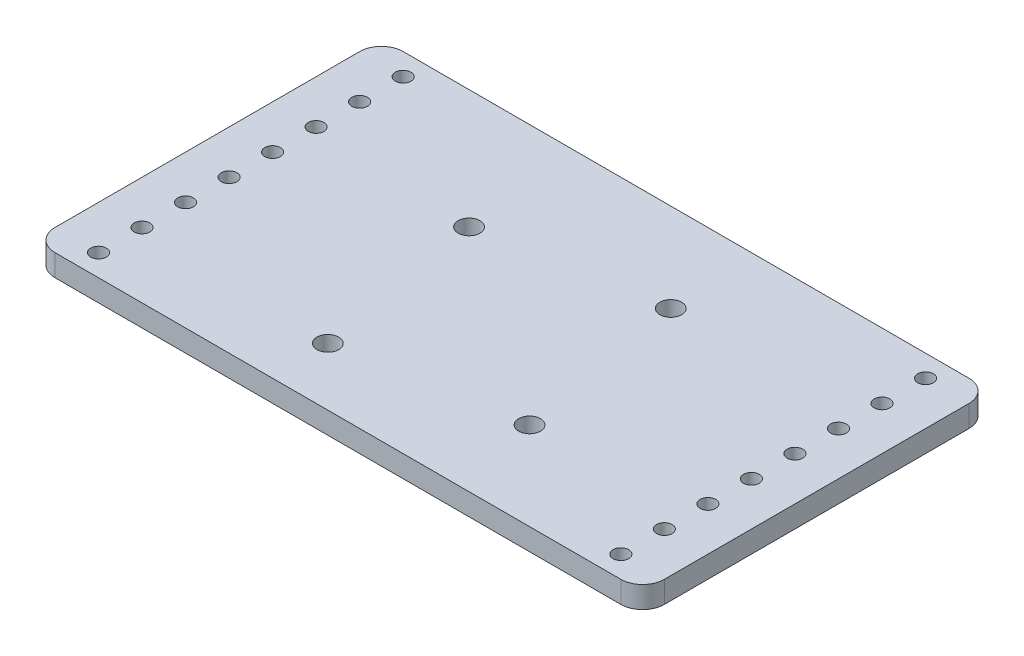
from build123d import *

# Parameters (mm, degrees)
SKETCH1_W                   = 177.8
SKETCH1_H                   = 101.6
INITIAL_PLATE_DEPTH         = 6.35
SKETCH2_R                   = 3.175
BEARING_STACK_HOLES_DEPTH   = 103.587389576
SKETCH3_R                   = 2.286
INITIAL_MOUNTING_HOLE_DEPTH = 103.587389576
MOUNTING_PATTERN_COUNT      = 8
MOUNTING_PATTERN_PITCH      = 12.7
FILLET1_R                   = 6.35


with BuildPart() as part:
    # Sketch1 → Initial Plate (new body)
    with BuildSketch(Plane(origin=(0, 0, 0), x_dir=(1, 0, 0), z_dir=(0, 1, 0))):
        Rectangle(SKETCH1_W, SKETCH1_H)
    extrude(amount=INITIAL_PLATE_DEPTH)

    # Sketch2 → Bearing Stack Holes (cut, through all)
    with BuildSketch(Plane(origin=(0, 6.35, 0), x_dir=(1, 0, 0), z_dir=(0, 1, 0))):
        with Locations((-28.630861171, 16.100912167)):
            Circle(SKETCH2_R)
        with Locations((-19.809533745, -33.927321686)):
            Circle(SKETCH2_R)
        with Locations((30.218700108, -25.105994261)):
            Circle(SKETCH2_R)
        with Locations((21.397372682, 24.922239592)):
            Circle(SKETCH2_R)
    extrude(amount=-BEARING_STACK_HOLES_DEPTH, mode=Mode.SUBTRACT)

    # Sketch3 → Initial Mounting Hole (cut, through all)
    with BuildSketch(Plane(origin=(0, 6.35, 0), x_dir=(1, 0, 0), z_dir=(0, 1, 0))):
        with Locations((-76.2, -44.45)):
            Circle(SKETCH3_R)
        with Locations((76.2, -44.45)):
            Circle(SKETCH3_R)
    initial_mounting_hole = extrude(amount=-INITIAL_MOUNTING_HOLE_DEPTH, mode=Mode.SUBTRACT)

    # Mounting Pattern: Initial Mounting Hole ×8
    with Locations(*[(0, 0, -i * MOUNTING_PATTERN_PITCH) for i in range(1, MOUNTING_PATTERN_COUNT)]):
        add(initial_mounting_hole, mode=Mode.SUBTRACT)

    # Fillet1
    fillet1_edges = [part.edges().sort_by_distance(p)[0] for p in [
        (88.9, 3.175, -50.8),
        (88.9, 3.175, 50.8),
        (-88.9, 3.175, 50.8),
        (-88.9, 3.175, -50.8),
    ]]
    fillet(fillet1_edges, radius=FILLET1_R)


solid = part.part
